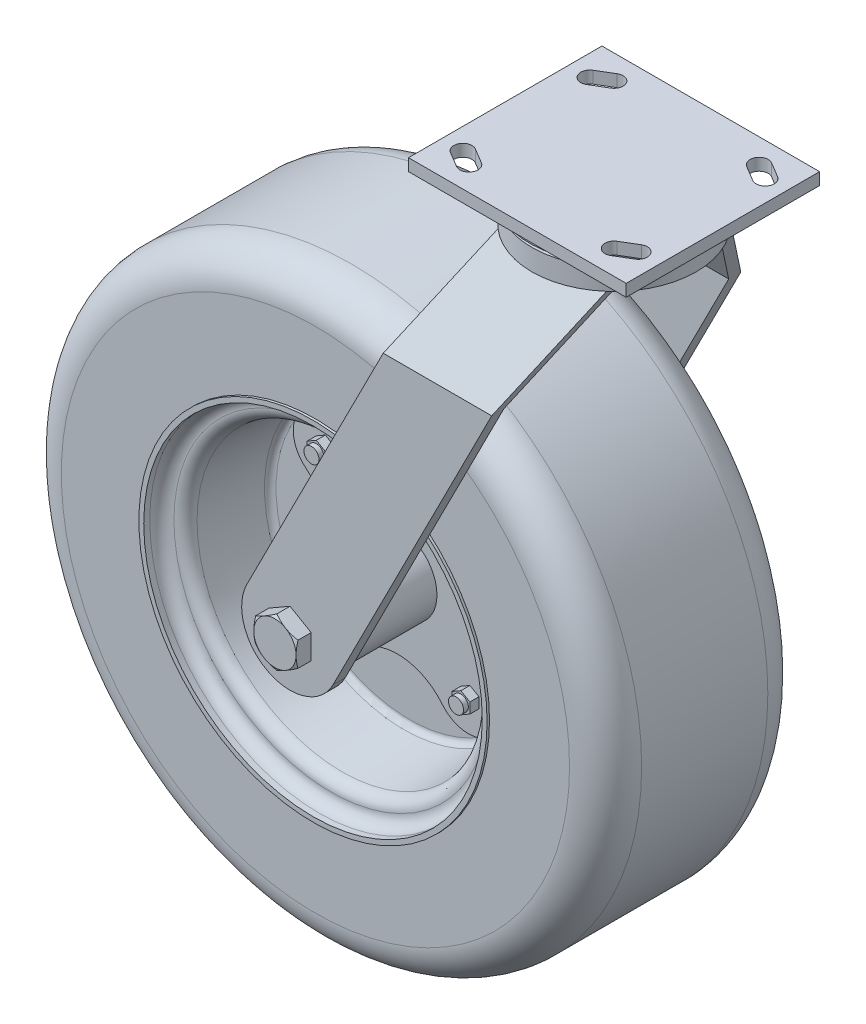
from build123d import *

# Parameters (mm, degrees)
SKETCH1_W               = 114.3
SKETCH1_H               = 6.35
BOSS_EXTRUDE1_DEPTH     = 50.8
F_1_2_HOLES_DEPTH       = 77.727341932
BOSS_EXTRUDE5_DEPTH     = 6.35
BOSS_EXTRUDE6_DEPTH     = 4.7625
SKETCH15_R              = 3.96875
BOSS_EXTRUDE7_DEPTH     = 2.54
SKETCH16_R              = 6.35
BOSS_EXTRUDE8_DEPTH     = 4.7625
SKETCH7_W               = 285.665653371
SKETCH7_H               = 130.81
BOSS_EXTRUDE2_DEPTH     = 358.6099
CUT_EXTRUDE1_START      = -130.81
CUT_EXTRUDE1_DEPTH      = 130.81
CUT_EXTRUDE3_DEPTH      = 359.77249205
CUT_EXTRUDE3_DEPTH_BACK = 359.77249205
SKETCH9_OUTSIDE_W       = 235.712
SKETCH9_OUTSIDE_H       = 490.665
BOSS_EXTRUDE3_DEPTH     = 7.9375
SKETCH11_OUTSIDE_W      = 2099.541
SKETCH11_OUTSIDE_H      = 2170.978
SKETCH11_OUTSIDE_R      = 11.1125
CUT_EXTRUDE4_DEPTH      = 484.944785887
CUT_EXTRUDE4_DRAFT      = -60
SKETCH12_R              = 10.795
BOSS_EXTRUDE4_DEPTH     = 118.11


# Read off the part's stored shape, not the designer's step: Cut-Extrude1
with BuildPart() as part:
    # Sketch1 → Boss-Extrude1 (new, symmetric)
    with BuildSketch(Plane.XY):
        with Locations((0, -3.175)):
            Rectangle(SKETCH1_W, SKETCH1_H)
    extrude(amount=BOSS_EXTRUDE1_DEPTH, both=True)

    # Sketch2 → 1-2 holes (cut, through all)
    with BuildSketch(Plane(origin=(0, 0, 0), x_dir=(1, 0, 0), z_dir=(0, 1, 0))):
        with BuildLine():
            Line((-35.649713965, 34.016189941), (-43.587213965, 29.253689941))
            ThreePointArc((-43.587213965, 29.253689941), (-50.121310059, 30.887213965), (-48.487786035, 37.421310059))
            Line((-48.487786035, 37.421310059), (-40.550286035, 42.183810059))
            ThreePointArc((-40.550286035, 42.183810059), (-34.016189941, 40.550286035), (-35.649713965, 34.016189941))
        make_face()
        with BuildLine():
            Line((-35.649713965, -34.016189941), (-43.587213965, -29.253689941))
            ThreePointArc((-43.587213965, -29.253689941), (-50.121310059, -30.887213965), (-48.487786035, -37.421310059))
            Line((-48.487786035, -37.421310059), (-40.550286035, -42.183810059))
            ThreePointArc((-40.550286035, -42.183810059), (-34.016189941, -40.550286035), (-35.649713965, -34.016189941))
        make_face()
        with BuildLine():
            Line((35.649713965, 34.016189941), (43.587213965, 29.253689941))
            ThreePointArc((43.587213965, 29.253689941), (50.121310059, 30.887213965), (48.487786035, 37.421310059))
            Line((48.487786035, 37.421310059), (40.550286035, 42.183810059))
            ThreePointArc((40.550286035, 42.183810059), (34.016189941, 40.550286035), (35.649713965, 34.016189941))
        make_face()
        with BuildLine():
            Line((35.649713965, -34.016189941), (43.587213965, -29.253689941))
            ThreePointArc((43.587213965, -29.253689941), (50.121310059, -30.887213965), (48.487786035, -37.421310059))
            Line((48.487786035, -37.421310059), (40.550286035, -42.183810059))
            ThreePointArc((40.550286035, -42.183810059), (34.016189941, -40.550286035), (35.649713965, -34.016189941))
        make_face()
    extrude(amount=-F_1_2_HOLES_DEPTH, mode=Mode.SUBTRACT)


with BuildPart() as body_2:
    # Sketch4 → Revolve1 (revolve)
    with BuildSketch(Plane.XY, mode=Mode.PRIVATE) as revolve1_sk:
        Polygon((0, -27.1526), (43.18, -27.1526), (43.18, -16.0401), (40.64, -16.0401), (40.64, -13.5001), (44.45, -13.5001), (44.45, -6.35), (0, -6.35), align=None)
    revolve(revolve1_sk.sketch.rotate(Axis((0, -6.35, 0), (0, -1, 0)), 180), axis=Axis((0, -6.35, 0), (0, -1, 0)))


with BuildPart() as body_3:
    # Sketch6 → Revolve2 (revolve)
    with BuildSketch(Plane(origin=(-104.775, 0, 0), x_dir=(0, 0, -1), z_dir=(1, 0, 0)), mode=Mode.PRIVATE) as revolve2_sk:
        with BuildLine():
            Line((-52.07, -141.9225), (-52.07, -99.897045455))
            ThreePointArc((-52.07, -99.897045455), (-46.524200035, -86.508299965), (-33.135454545, -80.9625))
            Line((-33.135454545, -80.9625), (-28.993522727, -80.9625))
            Line((-28.993522727, -80.9625), (-20.709659091, -80.9625))
            Line((-20.709659091, -80.9625), (-12.425795455, -80.9625))
            Line((-12.425795455, -80.9625), (-4.141931818, -80.9625))
            Line((-4.141931818, -80.9625), (4.141931818, -80.9625))
            Line((4.141931818, -80.9625), (12.425795455, -80.9625))
            Line((12.425795455, -80.9625), (20.709659091, -80.9625))
            Line((20.709659091, -80.9625), (28.993522727, -80.9625))
            Line((28.993522727, -80.9625), (33.135454545, -80.9625))
            ThreePointArc((33.135454545, -80.9625), (46.524200035, -86.508299965), (52.07, -99.897045455))
            Line((52.07, -99.897045455), (52.07, -141.9225))
            Line((52.07, -141.9225), (53.34, -141.9225))
            Line((53.34, -141.9225), (53.34, -144.4625))
            Line((53.34, -144.4625), (50.165, -144.4625))
            ThreePointArc((50.165, -144.4625), (45.674871939, -146.322371939), (43.815, -150.8125))
            ThreePointArc((43.815, -150.8125), (42.146711089, -155.102497818), (38.018438966, -157.138336333))
            Line((38.018438966, -157.138336333), (5.438280517, -159.988730853))
            ThreePointArc((5.438280517, -159.988730853), (3.374144456, -161.00665011), (2.54, -163.15164902))
            Line((2.54, -163.15164902), (2.54, -212.725))
            Line((2.54, -212.725), (53.34, -212.725))
            Line((53.34, -212.725), (56.515, -212.725))
            Line((56.515, -212.725), (56.515, -233.3625))
            Line((56.515, -233.3625), (-56.515, -233.3625))
            Line((-56.515, -233.3625), (-56.515, -212.725))
            Line((-56.515, -212.725), (-53.34, -212.725))
            Line((-53.34, -212.725), (-2.54, -212.725))
            Line((-2.54, -212.725), (-2.54, -163.15164902))
            ThreePointArc((-2.54, -163.15164902), (-3.374144456, -161.00665011), (-5.438280517, -159.988730853))
            Line((-5.438280517, -159.988730853), (-38.018438966, -157.138336333))
            ThreePointArc((-38.018438966, -157.138336333), (-42.146711089, -155.102497818), (-43.815, -150.8125))
            ThreePointArc((-43.815, -150.8125), (-45.674871939, -146.322371939), (-50.165, -144.4625))
            Line((-50.165, -144.4625), (-53.34, -144.4625))
            Line((-53.34, -144.4625), (-53.34, -141.9225))
            Line((-53.34, -141.9225), (-52.07, -141.9225))
        make_face()
    revolve(revolve2_sk.sketch.rotate(Axis((-104.775, -233.3625, 111.145303652), (0, 0, -1)), 90), axis=Axis((-104.775, -233.3625, 111.145303652), (0, 0, -1)))

    # Sketch13 → Boss-Extrude5 (add)
    with BuildSketch(Plane.XY.offset(2.54)):
        with BuildLine():
            ThreePointArc((-153.078698148, -209.932127396), (-154.421568841, -183.715931159), (-128.205372604, -185.058801852))
            ThreePointArc((-128.205372604, -185.058801852), (-104.775, -196.200549673), (-81.344627396, -185.058801852))
            ThreePointArc((-81.344627396, -185.058801852), (-55.128431159, -183.715931159), (-56.471301852, -209.932127396))
            ThreePointArc((-56.471301852, -209.932127396), (-67.613049673, -233.3625), (-56.471301852, -256.792872604))
            ThreePointArc((-56.471301852, -256.792872604), (-55.128431159, -283.009068841), (-81.344627396, -281.666198148))
            ThreePointArc((-81.344627396, -281.666198148), (-104.775, -270.524450327), (-128.205372604, -281.666198148))
            ThreePointArc((-128.205372604, -281.666198148), (-154.421568841, -283.009068841), (-153.078698148, -256.792872604))
            ThreePointArc((-153.078698148, -256.792872604), (-141.936950327, -233.3625), (-153.078698148, -209.932127396))
        make_face()
    extrude(amount=BOSS_EXTRUDE5_DEPTH)

    # Sketch14 → Boss-Extrude6 (add)
    with BuildSketch(Plane.XY.offset(8.89)):
        Polygon((-142.73701796, -200.899743354), (-137.97451796, -198.150112697), (-137.97451796, -192.650851383), (-142.73701796, -189.901220726), (-147.49951796, -192.650851383), (-147.49951796, -198.150112697), align=None)
        Polygon((-62.05048204, -198.150112697), (-66.81298204, -200.899743354), (-71.57548204, -198.150112697), (-71.57548204, -192.650851383), (-66.81298204, -189.901220726), (-62.05048204, -192.650851383), align=None)
        Polygon((-66.81298204, -265.825256646), (-71.57548204, -268.574887303), (-71.57548204, -274.074148617), (-66.81298204, -276.823779274), (-62.05048204, -274.074148617), (-62.05048204, -268.574887303), align=None)
        Polygon((-147.49951796, -268.574887303), (-142.73701796, -265.825256646), (-137.97451796, -268.574887303), (-137.97451796, -274.074148617), (-142.73701796, -276.823779274), (-147.49951796, -274.074148617), align=None)
    extrude(amount=BOSS_EXTRUDE6_DEPTH)

    # Sketch15 → Boss-Extrude7 (add)
    with BuildSketch(Plane.XY.offset(13.6525)):
        with Locations((-142.73701796, -195.40048204)):
            Circle(SKETCH15_R)
        with Locations(Location((-66.81298204, -195.40048204, 0), (0, 0, 180))):
            Circle(SKETCH15_R)
        with Locations(Location((-142.73701796, -271.32451796, 0), (0, 0, 180))):
            Circle(SKETCH15_R)
        with Locations((-66.81298204, -271.32451796)):
            Circle(SKETCH15_R)
    extrude(amount=BOSS_EXTRUDE7_DEPTH)

    # Sketch16 → Boss-Extrude8 (add)
    with BuildSketch(Plane(origin=(0, 0, -2.54), x_dir=(-1, 0, 0), z_dir=(0, 0, -1))):
        with Locations(Location((66.81298204, -195.40048204, 0), (0, 0, 180))):
            Circle(SKETCH16_R)
        with Locations(Location((142.73701796, -195.40048204, 0), (0, 0, 180))):
            Circle(SKETCH16_R)
        with Locations(Location((142.73701796, -271.32451796, 0), (0, 0, 180))):
            Circle(SKETCH16_R)
        with Locations(Location((66.81298204, -271.32451796, 0), (0, 0, 180))):
            Circle(SKETCH16_R)
    extrude(amount=BOSS_EXTRUDE8_DEPTH)


with BuildPart() as body_4:
    # Sketch7 → Boss-Extrude2 (new body)
    with BuildSketch(Plane.XZ.offset(27.1526)):
        with Locations((-114.342173315, 0)):
            Rectangle(SKETCH7_W, SKETCH7_H)
    extrude(amount=BOSS_EXTRUDE2_DEPTH)

    # Cut-Extrude1 outline → Cut-Extrude1 (cut)
    with BuildSketch(Plane.XY.offset(65.405).offset(CUT_EXTRUDE1_START)):
        with BuildLine():
            Line((28.490653371, -27.1526), (-82.130380672, -244.868203606))
            ThreePointArc((-82.130380672, -244.868203606), (-116.280703606, -256.007119328), (-127.419619328, -221.856796394))
            Line((-127.419619328, -221.856796394), (-28.490653371, -27.1526))
            Line((-28.490653371, -27.1526), (-257.175, -27.1526))
            Line((-257.175, -27.1526), (-257.175, -385.7625))
            Line((-257.175, -385.7625), (28.490653371, -385.7625))
            Line((28.490653371, -385.7625), (28.490653371, -27.1526))
        make_face()
    extrude(amount=CUT_EXTRUDE1_DEPTH, mode=Mode.SUBTRACT)

    # Sketch9 outside → Cut-Extrude3 (cut, two sides: drawn at the far end of the back side and taken through both)
    with BuildSketch(Plane(origin=(0, -144.306693689, 0), x_dir=(0, 0, -1), z_dir=(-1, 0, 0)).offset(-CUT_EXTRUDE3_DEPTH_BACK)):
        with Locations((0, 48.5745)):
            Rectangle(SKETCH9_OUTSIDE_W, SKETCH9_OUTSIDE_H)
        Polygon((65.405, 241.455806311), (65.405, -63.344193689), (32.446803702, -117.154093689), (26.096803702, -117.154093689), (59.055, -63.344193689), (59.055, 241.455806311), align=None, mode=Mode.SUBTRACT)
        Polygon((-26.096803702, -117.154093689), (-32.446803702, -117.154093689), (-65.405, -63.344193689), (-65.405, 241.455806311), (-59.055, 241.455806311), (-59.055, -63.344193689), align=None, mode=Mode.SUBTRACT)
    extrude(amount=CUT_EXTRUDE3_DEPTH + CUT_EXTRUDE3_DEPTH_BACK, mode=Mode.SUBTRACT)


with BuildPart() as cut_extrude3_piece_1:
    # of the separate pieces the step leaves, piece 1, a body of its own (cut_extrude3_pieces)
    add(body_4.part.solids().sort_by_distance((28.490653371, -27.1526, -32.446803702))[0])



with BuildPart() as cut_extrude3_piece_2:
    # of the separate pieces the step leaves, piece 2, a body of its own (cut_extrude3_pieces)
    add(body_4.part.solids().sort_by_distance((1.149908467, -80.9625, 65.405))[0])


with BuildPart() as body_6:
    # Sketch10 → Boss-Extrude3 (new body)
    with BuildSketch(Plane.XY.offset(65.405)):
        Polygon((-104.775, -220.530890267), (-115.8875, -226.946695134), (-115.8875, -239.778304866), (-104.775, -246.194109733), (-93.6625, -239.778304866), (-93.6625, -226.946695134), align=None)
    extrude(amount=BOSS_EXTRUDE3_DEPTH)


with BuildPart() as cut_extrude4_tool:
    # Sketch11 outside → Cut-Extrude4 (with draft: the straight prism first)
    with BuildSketch(Plane.XY.offset(73.3425)):
        with Locations((-100.0125, -192.881)):
            Rectangle(SKETCH11_OUTSIDE_W, SKETCH11_OUTSIDE_H)
        with Locations((-104.775, -233.3625)):
            Circle(SKETCH11_OUTSIDE_R, mode=Mode.SUBTRACT)
    extrude(amount=-CUT_EXTRUDE4_DEPTH)
    # Cut-Extrude4: the draft: its side faces are tilted about the plane it starts from
    cut_extrude4_sides = [cut_extrude4_tool.faces().sort_by_distance(p)[0] for p in [
        (-100.0125, -1278.37, -169.129892944),
        (949.758, -192.881, -169.129892944),
        (-100.0125, 892.608, -169.129892944),
        (-1149.783, -192.881, -169.129892944),
        (-115.8875, -233.3625, -169.129892944),
    ]]
    draft(cut_extrude4_sides, Plane.XY.offset(73.3425), CUT_EXTRUDE4_DRAFT)


with BuildPart() as body_6_1:
    add(body_6.part)

    # Cut-Extrude4: cut by cut_extrude4_tool
    add(cut_extrude4_tool.part, mode=Mode.SUBTRACT)


with BuildPart() as body_7:
    # Mirror1: mirrored copy
    add(body_6_1.part.mirror(Plane.XY))


with BuildPart() as cut_extrude3_piece_1_1:
    add(cut_extrude3_piece_1.part)

    add(cut_extrude3_piece_2.part)  # Boss-Extrude4 merges Cut-Extrude3 piece 2
    # Sketch12 → Boss-Extrude4 (add)
    with BuildSketch(Plane.XY.offset(-59.055)):
        with Locations(Location((-104.775, -233.3625, 0), (0, 0, 180))):
            Circle(SKETCH12_R)
    extrude(amount=BOSS_EXTRUDE4_DEPTH)

    # Combine1: union body 7, body 6, body 2, part
    add(body_7.part)
    add(body_6_1.part)
    add(body_2.part)
    add(part.part)


solid = Compound([body_3.part, cut_extrude3_piece_1_1.part])
